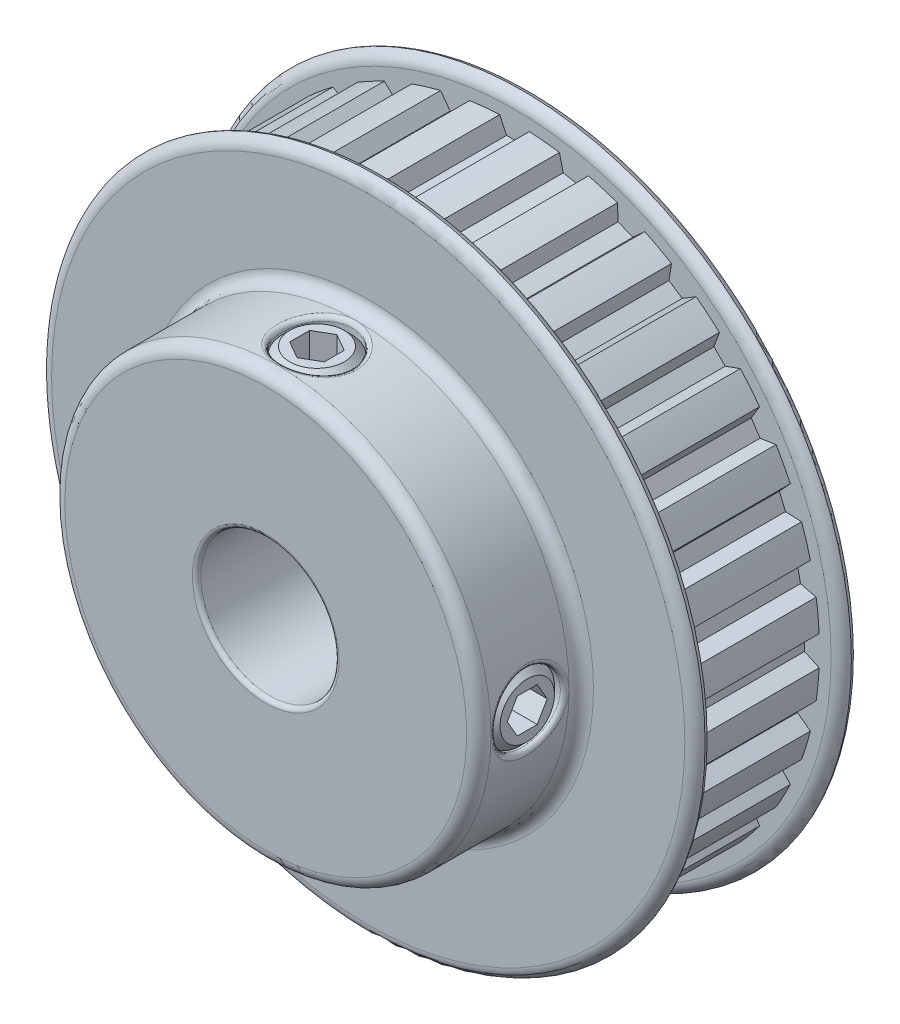
from build123d import *

# Parameters (mm, degrees)
CUT_EXTRUDE1_START = -10.05
CUT_EXTRUDE1_DEPTH = 11.2
CIRPATTERN1_COUNT  = 32
SKETCH4_R          = 3
CUT_EXTRUDE2_DEPTH = 42.927347877
CUT_EXTRUDE3_DEPTH = 2.25
CIRPATTERN2_COUNT  = 2
CIRPATTERN2_ANGLE  = 90
FILLET1_R          = 1.057142857
FILLET2_R          = 0.37


with BuildPart() as part:
    # Sketch7 → Revolve1 (revolve)
    with BuildSketch(Plane(origin=(0, 0, 0), x_dir=(0, 0, -1), z_dir=(1, 0, 0)), mode=Mode.PRIVATE) as revolve1_sk:
        with BuildLine():
            Line((-11.55, 6), (-11.55, 18.5))
            Line((-11.55, 18.5), (-2.65, 18.5))
            Line((-2.65, 18.5), (-2.65, 28.5))
            Line((-2.65, 28.5), (-1.9, 28.5))
            ThreePointArc((-1.9, 28.5), (-1.358015269, 28.119219543), (-1.15, 27.49035481))
            Line((-1.15, 27.49035481), (-1.15, 26.480709619))
            Line((-1.15, 26.480709619), (10.05, 26.480709619))
            Line((10.05, 26.480709619), (10.05, 27.49035481))
            ThreePointArc((10.05, 27.49035481), (10.258015269, 28.119219543), (10.8, 28.5))
            Line((10.8, 28.5), (11.55, 28.5))
            Line((11.55, 28.5), (11.55, 6))
            Line((11.55, 6), (-11.55, 6))
        make_face()
    revolve(revolve1_sk.sketch.rotate(Axis((0, 0, 11.55), (0, 0, -1)), 90), axis=Axis((0, 0, 11.55), (0, 0, -1)))

    # Sketch3 → Cut-Extrude1 (cut)
    with BuildSketch(Plane.XY.offset(CUT_EXTRUDE1_START)):
        with BuildLine():
            Line((-0.690489274, 25.179625), (0.690489274, 25.179625))
            Line((0.690489274, 25.179625), (1.2827, 26.449625))
            ThreePointArc((1.2827, 26.449625), (0, 26.480709619), (-1.2827, 26.449625))
            Line((-1.2827, 26.449625), (-0.690489274, 25.179625))
        make_face()
    cut_extrude1 = extrude(amount=CUT_EXTRUDE1_DEPTH, mode=Mode.SUBTRACT)

    # CirPattern1: Cut-Extrude1 ×32 about axis
    cirpattern1_axis = Axis((0, 0, 0), (0, 0, 1))
    for i in range(1, CIRPATTERN1_COUNT):
        add(cut_extrude1.rotate(cirpattern1_axis, i * 360 / CIRPATTERN1_COUNT), mode=Mode.SUBTRACT)

    # Sketch4 → Cut-Extrude2 (cut, through all)
    with BuildSketch(Plane(origin=(0, 0, 0), x_dir=(1, 0, 0), z_dir=(0, 1, 0))):
        with Locations(Location((0, -7.1, 0), (0, 0, 90))):
            Circle(SKETCH4_R)
    cut_extrude2 = extrude(amount=CUT_EXTRUDE2_DEPTH, mode=Mode.SUBTRACT)

    # Sketch5 → Revolve2 (revolve)
    with BuildSketch(Plane.XY.offset(7.1), mode=Mode.PRIVATE) as revolve2_sk:
        Polygon((0, 18.255136264), (0, 6), (-2.365, 6), (-3, 6.635), (-3, 17.620136264), (-2.365, 18.255136264), align=None)
    revolve2 = revolve(revolve2_sk.sketch.rotate(Axis((0, 0, 7.1), (0, 1, 0)), 270), axis=Axis((0, 0, 7.1), (0, 1, 0)))

    # Sketch6 → Cut-Extrude3 (cut)
    with BuildSketch(Plane(origin=(0, 18.255136264, 0), x_dir=(-1, 0, 0), z_dir=(0, -1, 0))):
        Polygon((0, -5.367949192), (-1.5, -6.233974596), (-1.5, -7.966025404), (0, -8.832050808), (1.5, -7.966025404), (1.5, -6.233974596), align=None)
    cut_extrude3 = extrude(amount=CUT_EXTRUDE3_DEPTH, mode=Mode.SUBTRACT)

    # CirPattern2: Cut-Extrude2, Revolve2, Cut-Extrude3 ×2 about axis
    cirpattern2_axis = Axis((0, 0, 0), (0, 0, -1))
    add([cut_extrude2.rotate(cirpattern2_axis, i * CIRPATTERN2_ANGLE / (CIRPATTERN2_COUNT - 1)) for i in range(1, CIRPATTERN2_COUNT)], mode=Mode.SUBTRACT)
    add([revolve2.rotate(cirpattern2_axis, i * CIRPATTERN2_ANGLE / (CIRPATTERN2_COUNT - 1)) for i in range(1, CIRPATTERN2_COUNT)])
    add([cut_extrude3.rotate(cirpattern2_axis, i * CIRPATTERN2_ANGLE / (CIRPATTERN2_COUNT - 1)) for i in range(1, CIRPATTERN2_COUNT)], mode=Mode.SUBTRACT)

    # Fillet1
    # the kernel refuses this fillet: 1.057142857 mm, written as the material it adds along each edge
    with BuildSketch(Plane(origin=(0, 0, 2.65), x_dir=(1, 0, 0), z_dir=(0, 1, 0))) as fillet1_piece_1:
        with BuildLine():
            CenterArc((18.5 + FILLET1_R, -FILLET1_R), FILLET1_R, 90, 90)
            Line((18.5 + FILLET1_R, 0), (18.5, 0))
            Line((18.5, 0), (18.5, -FILLET1_R))
        make_face()
    revolve(axis=Axis((0, 0, 2.65), (0, 0, -1)))
    # the kernel refuses this fillet: 1.057142857 mm, written as the material it takes off along each edge
    with BuildSketch(Plane(origin=(0, 0, -11.55), x_dir=(1, 0, 0), z_dir=(0, 1, 0))) as fillet1_2_piece_1:
        with BuildLine():
            CenterArc((27.488459449, -1.057142857), FILLET1_R, 16.890320162, 73.109679838)
            Line((28.5, -0.75), (28.5, 0))
            Line((28.5, 0), (27.488459449, 0))
        make_face()
    revolve(axis=Axis((0, 0, -11.55), (0, 0, -1)), mode=Mode.SUBTRACT)
    with BuildSketch(Plane(origin=(0, 0, 11.55), x_dir=(1, 0, 0), z_dir=(0, 1, 0))) as fillet1_2_piece_2:
        with BuildLine():
            CenterArc((18.5 - FILLET1_R, FILLET1_R), FILLET1_R, 270, 90)
            Line((18.5, FILLET1_R), (18.5, 0))
            Line((18.5, 0), (18.5 - FILLET1_R, 0))
        make_face()
    revolve(axis=Axis((0, 0, 11.55), (0, 0, -1)), mode=Mode.SUBTRACT)
    with BuildSketch(Plane(origin=(0, 0, 2.65), x_dir=(1, 0, 0), z_dir=(0, 1, 0))) as fillet1_2_piece_3:
        with BuildLine():
            CenterArc((27.488459449, 1.057142857), FILLET1_R, 270, 73.109679838)
            Line((28.5, 0.75), (28.5, 0))
            Line((28.5, 0), (27.488459449, 0))
        make_face()
    revolve(axis=Axis((0, 0, 2.65), (0, 0, -1)), mode=Mode.SUBTRACT)

    # Fillet2
    fillet2_edges = [part.edges().sort_by_distance(p)[0] for p in [
        (-6, 0, -11.55),
        (2e-09, 18.500000002, 10.100000001),
        (18.255136264, -3, 7.1),
        (-6, 0, 11.55),
    ]]
    fillet(fillet2_edges, radius=FILLET2_R)


solid = part.part
